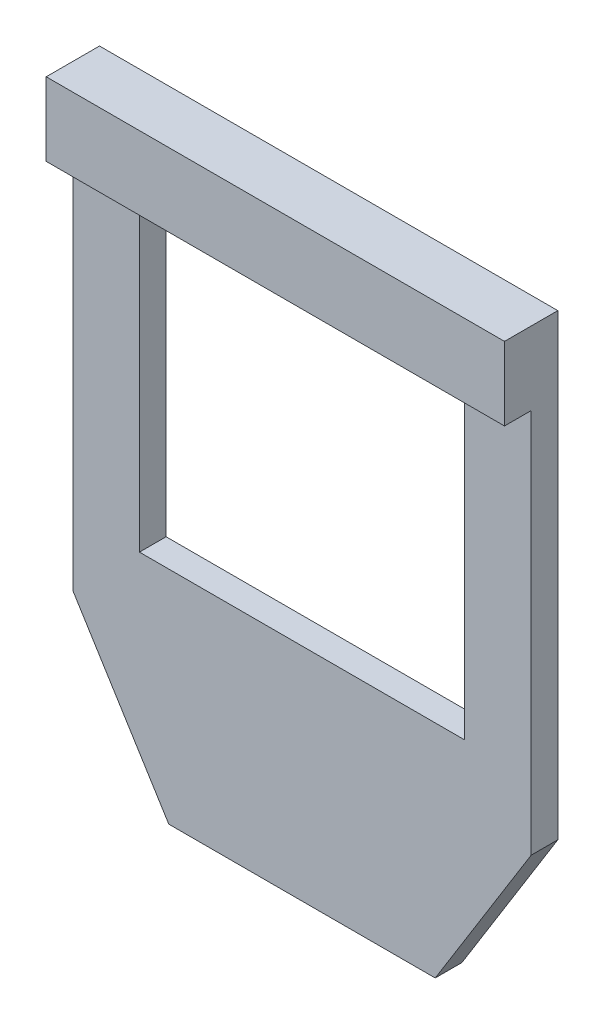
from build123d import *

# Parameters (mm, degrees)
SKETCH1_W           = 122
SKETCH1_H           = 122
BOSS_EXTRUDE1_DEPTH = 10
SKETCH2_W           = 172
SKETCH2_H           = 27.5
BOSS_EXTRUDE2_DEPTH = 10


with BuildPart() as part:
    # Sketch1 → Boss-Extrude1 (new body)
    with BuildSketch(Plane.XY):
        Polygon((-64.181590551, 136.649925771), (-64.181590551, -35.350074229), (-28.180190776, -93.263143268), (71.817009673, -93.263143268), (107.818409449, -35.350074229), (107.818409449, 136.649925771), align=None)
        with Locations((21.818409449, 50.649925771)):
            Rectangle(SKETCH1_W, SKETCH1_H, mode=Mode.SUBTRACT)
    extrude(amount=BOSS_EXTRUDE1_DEPTH)

    # Sketch2 → Boss-Extrude2 (add)
    with BuildSketch(Plane.XY.offset(10)):
        with Locations((21.818409449, 122.899925771)):
            Rectangle(SKETCH2_W, SKETCH2_H)
    extrude(amount=BOSS_EXTRUDE2_DEPTH)


solid = part.part
